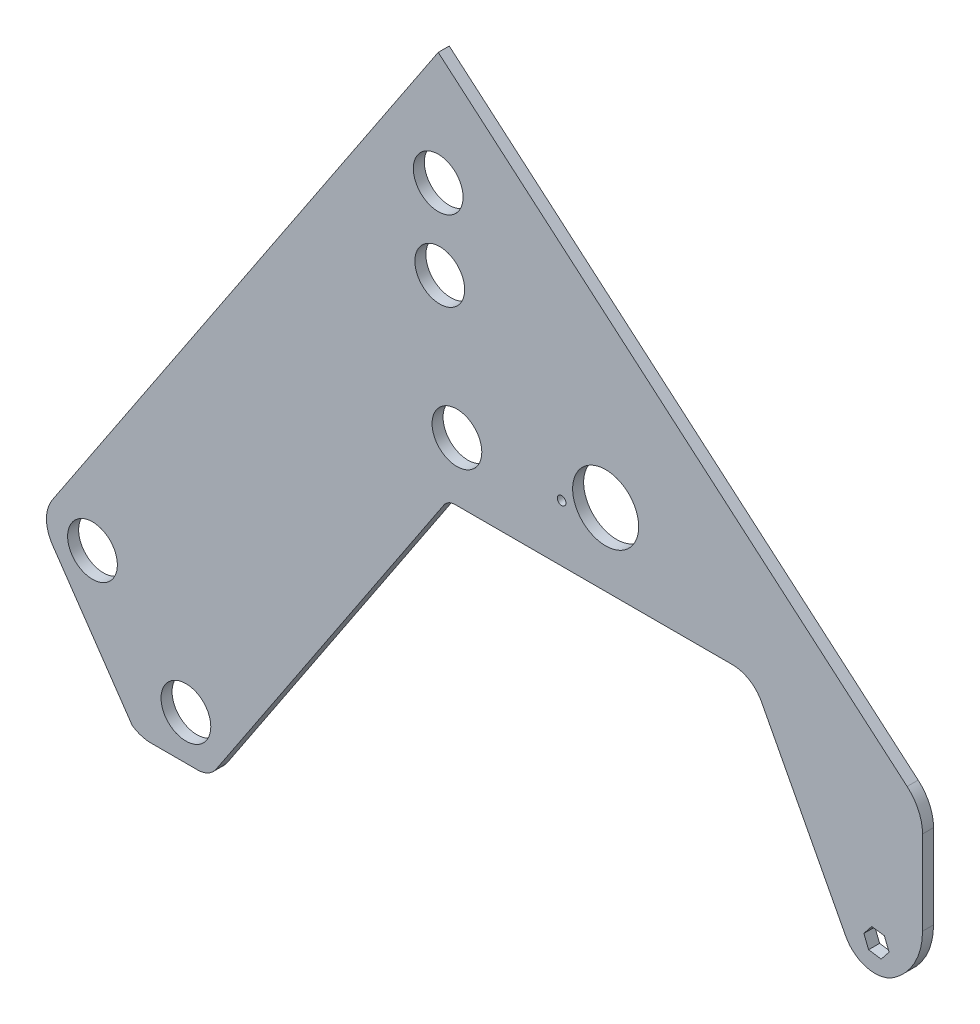
from build123d import *

# Parameters (mm, degrees)
MODEL_R             = 14.351
MODEL_R_2           = 2.4892
MODEL_R_3           = 19.05
BOSS_EXTRUDE1_DEPTH = 6.35


with BuildPart() as part:
    # Model → Boss-Extrude1 (new body)
    with BuildSketch(Plane.XY):
        with BuildLine():
            ThreePointArc((-201.896293348, 128.965545193), (-199.150490541, 131.463069475), (-195.550513781, 132.367076076))
            Line((-195.550513781, 132.367076076), (-35.622043863, 132.367076076))
            ThreePointArc((-35.622043863, 132.367076076), (-25.760728738, 129.616062671), (-18.747561656, 122.157570985))
            Line((-18.747561656, 122.157570985), (29.834784921, 29.424986287))
            ThreePointArc((29.834784921, 29.424986287), (42.069318683, 19.789188862), (57.40478967, 22.501335246))
            ThreePointArc((57.40478967, 22.501335246), (69.678332864, 36.188509018), (74.113744586, 54.029633177))
            Line((74.113744586, 54.029633177), (74.113744586, 102.606133034))
            ThreePointArc((74.113744586, 102.606133034), (71.785998082, 113.228332364), (65.229404538, 121.903619304))
            Line((65.229404538, 121.903619304), (-205.222037994, 353.368173587))
            Line((-205.222037994, 353.368173587), (-427.816029905, 18.523383567))
            ThreePointArc((-427.816029905, 18.523383567), (-431.177588774, 7.257144512), (-427.664089388, -3.962639022))
            Line((-427.664089388, -3.962639022), (-381.669104642, -71.16436512))
            ThreePointArc((-381.669104642, -71.16436512), (-376.555221076, -73.625461154), (-370.943257121, -74.470836451))
            Line((-370.943257121, -74.470836451), (-343.941809725, -74.470836451))
            ThreePointArc((-343.941809725, -74.470836451), (-337.94184846, -72.964158783), (-333.365510447, -68.801618312))
            Line((-333.365510447, -68.801618312), (-201.896293348, 128.965545193))
        make_face()
        with Locations((-350.749396053, -49.070836451)):
            Circle(MODEL_R, mode=Mode.SUBTRACT)
        with Locations((-404.630932779, 4.810700275)):
            Circle(MODEL_R, mode=Mode.SUBTRACT)
        Polygon((52.103706652, 40.741967437), (54.811502378, 33.927924905), (50.264266306, 28.175883751), (43.009234507, 29.23788513), (40.30143878, 36.051927662), (44.848674853, 41.803968816), align=None, mode=Mode.SUBTRACT)
        with Locations((-194.433992796, 166.233742743)):
            Circle(MODEL_R, mode=Mode.SUBTRACT)
        with Locations((-204.328455397, 242.433742743)):
            Circle(MODEL_R, mode=Mode.SUBTRACT)
        with Locations((-205.222037994, 288.153742743)):
            Circle(MODEL_R, mode=Mode.SUBTRACT)
        with Locations((-134.044120223, 165.1)):
            Circle(MODEL_R_2, mode=Mode.SUBTRACT)
        with Locations((-108.644120223, 174.189845259)):
            Circle(MODEL_R_3, mode=Mode.SUBTRACT)
    extrude(amount=BOSS_EXTRUDE1_DEPTH)


solid = part.part
